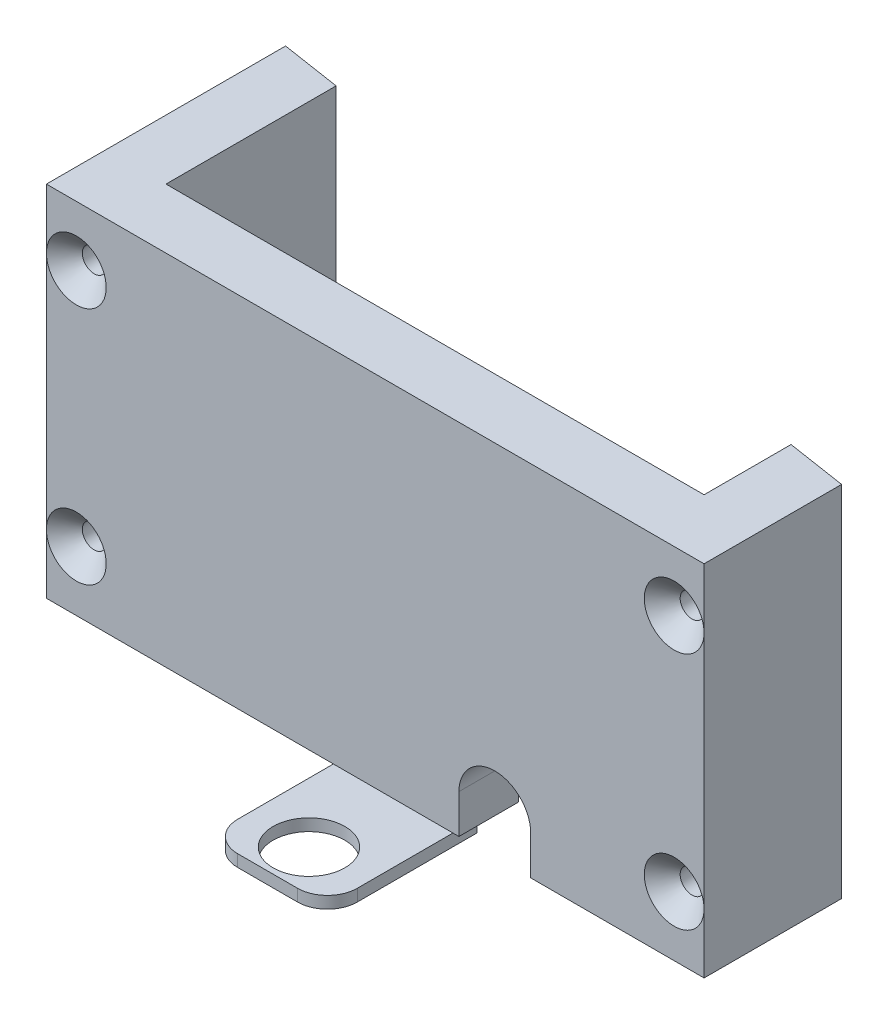
from build123d import *

# Parameters (mm, degrees)
ESQUISSE1_W             = 110
ESQUISSE1_H             = 60
BOSS_EXTRU_1_DEPTH      = 10
ESQUISSE7_W             = 10
ESQUISSE7_H             = 60
BOSS_EXTRU_3_DEPTH      = 30
ENL_V_MAT_EXTRU_2_DEPTH = 81
ESQUISSE9_R             = 2
ENL_V_MAT_EXTRU_3_DEPTH = 132.52946438
CHANFREIN1_SIZE         = 3
ENL_V_MAT_EXTRU_4_DEPTH = 10
BOSS_EXTRU_4_DEPTH      = 20
ESQUISSE11_R            = 6
ENL_V_MAT_EXTRU_6_DEPTH = 23
BOSS_EXTRU_5_DEPTH      = 20
ESQUISSE13_R            = 6
ENL_V_MAT_EXTRU_7_DEPTH = 20
CONG_1_R                = 5
CONG_2_R                = 5


with BuildPart() as part:
    # Esquisse1 → Boss.-Extru.1 (new body)
    with BuildSketch(Plane.XY):
        with Locations((55, -30)):
            Rectangle(ESQUISSE1_W, ESQUISSE1_H)
    extrude(amount=BOSS_EXTRU_1_DEPTH)

    # Esquisse7 → Boss.-Extru.3 (add)
    with BuildSketch(Plane(origin=(0, 0, 0), x_dir=(-1, 0, 0), z_dir=(0, 0, -1))):
        with Locations((-105, -30)):
            Rectangle(ESQUISSE7_W, ESQUISSE7_H)
        with Locations((-5, -30)):
            Rectangle(ESQUISSE7_W, ESQUISSE7_H)
    extrude(amount=BOSS_EXTRU_3_DEPTH)

    # Esquisse8 → Enlèv. mat.-Extru.2 (cut)
    with BuildSketch(Plane.XZ.offset(60)):
        Polygon((0, -30), (110, -13), (110, -30), align=None)
    extrude(amount=-ENL_V_MAT_EXTRU_2_DEPTH, mode=Mode.SUBTRACT)

    # Esquisse9 → Enlèv. mat.-Extru.3 (cut, through all)
    with BuildSketch(Plane.XY.offset(10)):
        with Locations((5, -10)):
            Circle(ESQUISSE9_R)
        with Locations((105, -10)):
            Circle(ESQUISSE9_R)
        with Locations((105, -50)):
            Circle(ESQUISSE9_R)
        with Locations((5, -50)):
            Circle(ESQUISSE9_R)
    extrude(amount=-ENL_V_MAT_EXTRU_3_DEPTH, mode=Mode.SUBTRACT)

    # Chanfrein1
    chanfrein1_edges = [part.edges().sort_by_distance(p)[0] for p in [
        (3, -50, 10),
        (103, -50, 10),
        (103, -10, 10),
        (3, -10, 10),
    ]]
    chamfer(chanfrein1_edges, length=CHANFREIN1_SIZE - 0.0001)  # a hair under: the kernel refuses the full size

    # Esquisse3 → Enlèv. mat.-Extru.4 (cut)
    with BuildSketch(Plane.XY.offset(10)):
        with BuildLine():
            Line((81, -53.5), (81, -60))
            Line((81, -60), (69, -60))
            Line((69, -60), (69, -53.5))
            ThreePointArc((69, -53.5), (75, -47.5), (81, -53.5))
        make_face()
    extrude(amount=-ENL_V_MAT_EXTRU_4_DEPTH, mode=Mode.SUBTRACT)


with BuildPart() as body_2:
    # Esquisse10 → Boss.-Extru.4 (new body)
    with BuildSketch(Plane.ZY.offset(-85)):
        Polygon((-2, -24.681592678), (0, -24.681592678), (0, -42), (-7.557736721, -42), (-7.557736721, -62.393293987), (-9.557736721, -62.393293987), (-9.557736721, -40), (-2, -40), align=None)
    extrude(amount=BOSS_EXTRU_4_DEPTH)

    # Esquisse11 → Enlèv. mat.-Extru.6 (cut)
    with BuildSketch(Plane.XY.offset(-7.557736721)):
        with Locations((75, -53.5)):
            Circle(ESQUISSE11_R)
    extrude(amount=-ENL_V_MAT_EXTRU_6_DEPTH, mode=Mode.SUBTRACT)

    # Congé2
    cong_2_edges = [body_2.edges().sort_by_distance(p)[0] for p in [
        (85, -62.393293987, -8.557736721),
        (65, -62.393293987, -8.557736721),
    ]]
    fillet(cong_2_edges, radius=CONG_2_R)


with BuildPart() as body_3:
    # Esquisse12 → Boss.-Extru.5 (new body)
    with BuildSketch(Plane(origin=(40, 0, 0), x_dir=(0, 0, -1), z_dir=(1, 0, 0))):
        Polygon((0, -48), (0, -68), (-23, -68), (-23, -70), (2, -70), (2, -48), align=None)
    extrude(amount=BOSS_EXTRU_5_DEPTH)

    # Esquisse13 → Enlèv. mat.-Extru.7 (cut)
    with BuildSketch(Plane.XZ.offset(70)):
        with Locations(Location((50, 16.082321447, 0), (0, 0, 270))):
            Circle(ESQUISSE13_R)
    extrude(amount=-ENL_V_MAT_EXTRU_7_DEPTH, mode=Mode.SUBTRACT)

    # Congé1
    cong_1_edges = [body_3.edges().sort_by_distance(p)[0] for p in [
        (60, -69, 23),
        (40, -69, 23),
    ]]
    fillet(cong_1_edges, radius=CONG_1_R)


solid = Compound([part.part, body_2.part, body_3.part])
